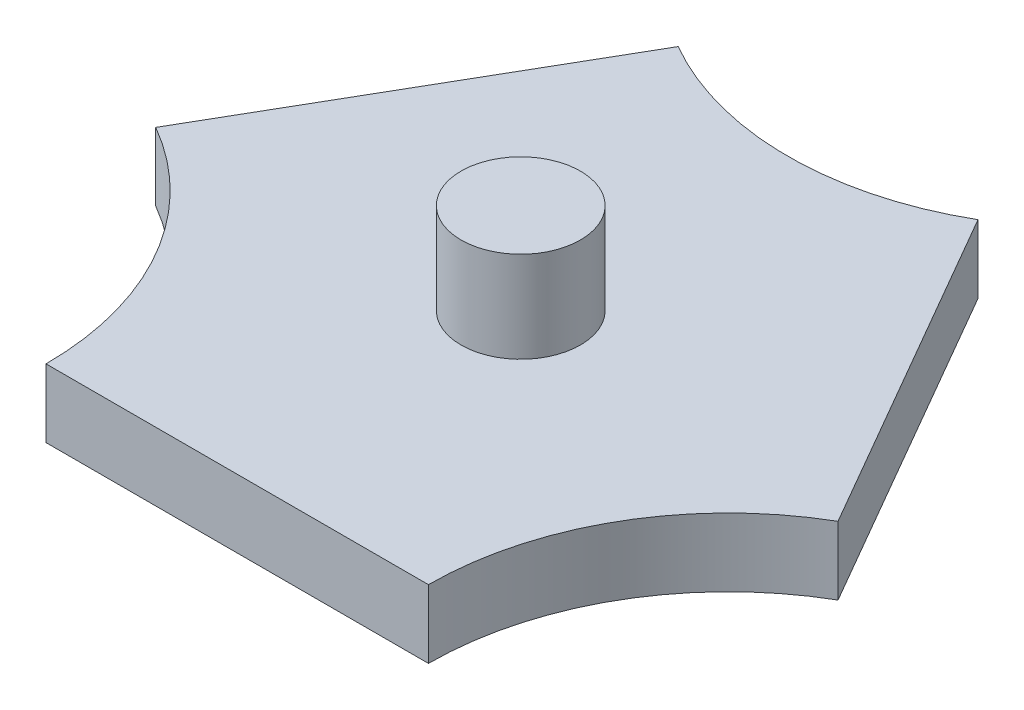
from build123d import *

# Parameters (mm, degrees)
BOSS_EXTRUDE1_DEPTH = 3
SKETCH2_R           = 2.625
BOSS_EXTRUDE2_DEPTH = 4


with BuildPart() as part:
    # Sketch1 → Boss-Extrude1 (new body)
    with BuildSketch(Plane(origin=(0, 0, 0), x_dir=(1, 0, 0), z_dir=(0, 1, 0))):
        with BuildLine():
            Line((6.591682084, 11.417128277), (15, 25.980762114))
            ThreePointArc((15, 25.980762114), (21.591682084, 24.214526222), (28.183364168, 25.980762114))
            Line((28.183364168, 25.980762114), (36.591682084, 11.417128277))
            ThreePointArc((36.591682084, 11.417128277), (31.766235891, 6.591682084), (30, 0))
            Line((30, 0), (13.183364168, 0))
            ThreePointArc((13.183364168, 0), (11.417128277, 6.591682084), (6.591682084, 11.417128277))
        make_face()
    extrude(amount=BOSS_EXTRUDE1_DEPTH)

    # Sketch2 → Boss-Extrude2 (add)
    with BuildSketch(Plane(origin=(0, 3, 0), x_dir=(1, 0, 0), z_dir=(0, 1, 0))):
        with Locations((21.591682084, 12.465963463)):
            Circle(SKETCH2_R)
    extrude(amount=BOSS_EXTRUDE2_DEPTH)


solid = part.part
